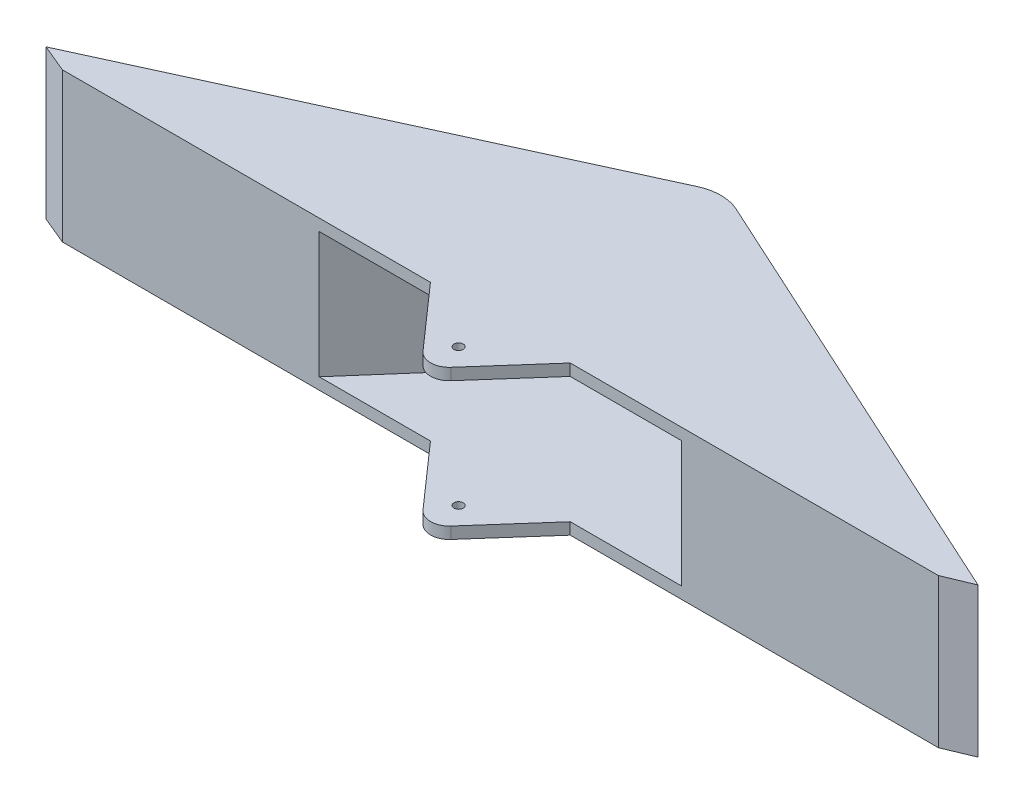
from build123d import *

# Parameters (mm, degrees)
BOSS_EXTRUDE1_DEPTH  = 1.25
BOSS_EXTRUDE8_START  = -8
BOSS_EXTRUDE8_DEPTH  = 16
CHAMFER2_SIZE2       = 3
CHAMFER2_SIZE        = 1.25
CHAMFER3_SIZE2       = 3
CHAMFER3_SIZE        = 1.25
BOSS_EXTRUDE9_DEPTH  = 1.25
BOSS_EXTRUDE10_DEPTH = 1.25
CUT_EXTRUDE1_REACH   = 59.082
SKETCH6_R            = 0.5


with BuildPart() as part:
    # Sketch1 → Boss-Extrude1 (new body)
    with BuildSketch(Plane(origin=(0, 0, 0), x_dir=(1, 0, 0), z_dir=(0, 1, 0))):
        with BuildLine():
            Line((-50, 0), (-2.082988952, 21.95833302))
            ThreePointArc((-2.082988952, 21.95833302), (0, 22.412878475), (2.082988952, 21.95833302))
            Line((2.082988952, 21.95833302), (50, 0))
            Line((50, 0), (20, 0))
            Line((20, 0), (0.753370804, 22.049783791))
            ThreePointArc((0.753370804, 22.049783791), (0, 22.392187842), (-0.753370804, 22.049783791))
            Line((-0.753370804, 22.049783791), (-20, 0))
            Line((-20, 0), (-50, 0))
        make_face()
    extrude(amount=BOSS_EXTRUDE1_DEPTH)


with BuildPart() as body_2:
    # Body-Move/Copy1: copy of part
    add(part.part.moved(Location((0, 14.75, 0))))


with BuildPart() as part_1:
    add(part.part)

    add(body_2.part)  # Boss-Extrude8 merges body 2
    # Sketch3 → Boss-Extrude8 (add)
    with BuildSketch(Plane(origin=(0, 8, 0), x_dir=(1, 0, 0), z_dir=(0, 1, 0)).offset(BOSS_EXTRUDE8_START)):
        with BuildLine():
            Line((19.431879943, -1.25), (0, 21.012015184))
            Line((0, 21.012015184), (-19.431879943, -1.25))
            Line((-19.431879943, -1.25), (-50, -1.25))
            Line((-50, -1.25), (-50, 0))
            Line((-50, 0), (-20, 0))
            Line((-20, 0), (-0.753370804, 22.049783791))
            ThreePointArc((-0.753370804, 22.049783791), (0, 22.392187842), (0.753370804, 22.049783791))
            Line((0.753370804, 22.049783791), (20, 0))
            Line((20, 0), (50, 0))
            Line((50, 0), (50, -1.25))
            Line((50, -1.25), (19.431879943, -1.25))
        make_face()
    extrude(amount=BOSS_EXTRUDE8_DEPTH)

    # Chamfer2
    chamfer2_edges = [part_1.edges().sort_by_distance(p)[0] for p in [
        (50, 8, 1.25),
    ]]
    chamfer2_side = [part_1.faces().sort_by_distance(p)[0] for p in [
        (50, 8, 1.225),
    ]]
    chamfer(chamfer2_edges, length=CHAMFER2_SIZE - 0.0001, length2=CHAMFER2_SIZE2 - 0.0001, reference=chamfer2_side[0])  # a hair under: the kernel refuses the full size

    # Chamfer3
    chamfer3_edges = [part_1.edges().sort_by_distance(p)[0] for p in [
        (-50, 8, 1.25),
    ]]
    chamfer3_side = [part_1.faces().sort_by_distance(p)[0] for p in [
        (-50, 8, 1.225),
    ]]
    chamfer(chamfer3_edges, length=CHAMFER3_SIZE - 0.0001, length2=CHAMFER3_SIZE2 - 0.0001, reference=chamfer3_side[0])  # a hair under: the kernel refuses the full size

    # Sketch4 → Boss-Extrude9 (add)
    with BuildSketch(Plane(origin=(0, 16, 0), x_dir=(1, 0, 0), z_dir=(0, 1, 0))):
        Polygon((-19.431879943, -1.25), (0, 21.012015184), (19.431879943, -1.25), align=None)
    boss_extrude9 = extrude(amount=-BOSS_EXTRUDE9_DEPTH)

    # Mirror1: Boss-Extrude9 across plane
    add(boss_extrude9.mirror(Plane.ZX.offset(8)))

    # Sketch5 → Boss-Extrude10 (add)
    with BuildSketch(Plane.XZ):
        with BuildLine():
            Line((-7.5, 1.25), (7.5, 1.25))
            Line((7.5, 1.25), (1.499675711, 8.050367528))
            ThreePointArc((1.499675711, 8.050367528), (0, 8.727124254), (-1.499675711, 8.050367528))
            Line((-1.499675711, 8.050367528), (-7.5, 1.25))
        make_face()
    boss_extrude10 = extrude(amount=-BOSS_EXTRUDE10_DEPTH)

    # Mirror2: Boss-Extrude10 across plane
    add(boss_extrude10.mirror(Plane.ZX.offset(8)))

    # Sketch6 → Cut-Extrude1 (cut, up to next)
    with BuildSketch(Plane(origin=(0, 0, 0), x_dir=(-1, 0, 0), z_dir=(0, -1, 0)), mode=Mode.PRIVATE) as cut_extrude1_sk1:
        with Locations(Location((0, -5.727124254, 0), (0, 0, 90))):
            Circle(SKETCH6_R)
    cut_extrude1_tool1 = extrude(cut_extrude1_sk1.sketch, amount=-CUT_EXTRUDE1_REACH, mode=Mode.PRIVATE) & part_1.part
    add(cut_extrude1_tool1.solids().sort_by_distance((0, 0, 5.727124))[0], mode=Mode.SUBTRACT)
    add(cut_extrude1_tool1.solids().sort_by_distance((0, 0, 5.727124))[1], mode=Mode.SUBTRACT)


solid = part_1.part
